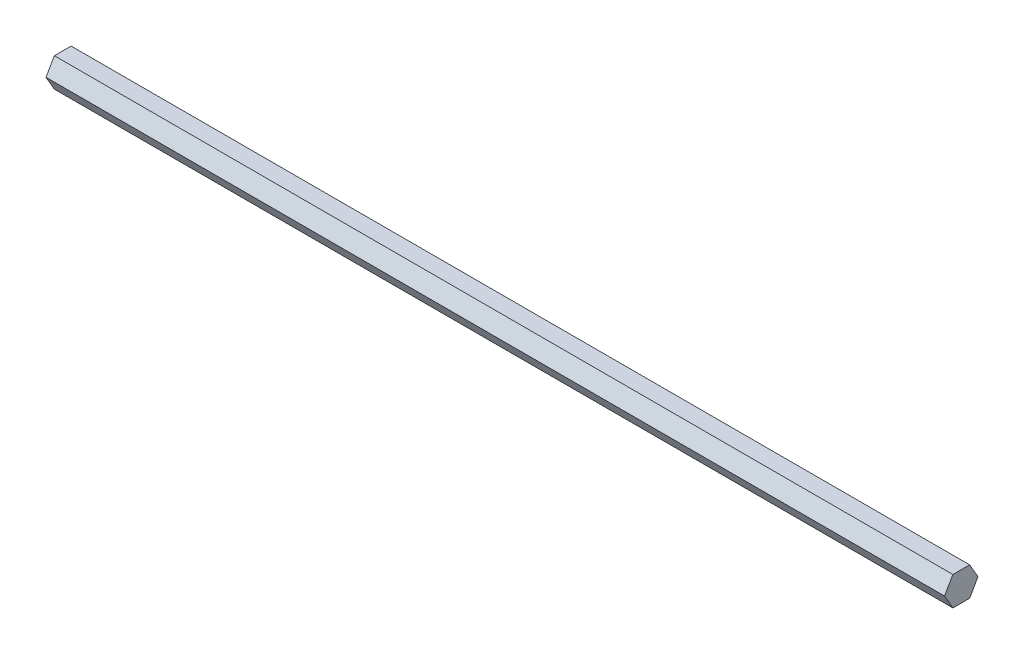
from build123d import *

# Parameters (mm, degrees)
BOSS_EXTRUDE1_DEPTH = 196.85


with BuildPart() as part:
    # Sketch1 → Boss-Extrude1 (new, symmetric)
    with BuildSketch(Plane(origin=(0, 0, 0), x_dir=(0, 0, -1), z_dir=(1, 0, 0))):
        Polygon((7.332348419, 0), (3.666174209, 6.35), (-3.666174209, 6.35), (-7.332348419, 0), (-3.666174209, -6.35), (3.666174209, -6.35), align=None)
    extrude(amount=BOSS_EXTRUDE1_DEPTH, both=True)


solid = part.part
